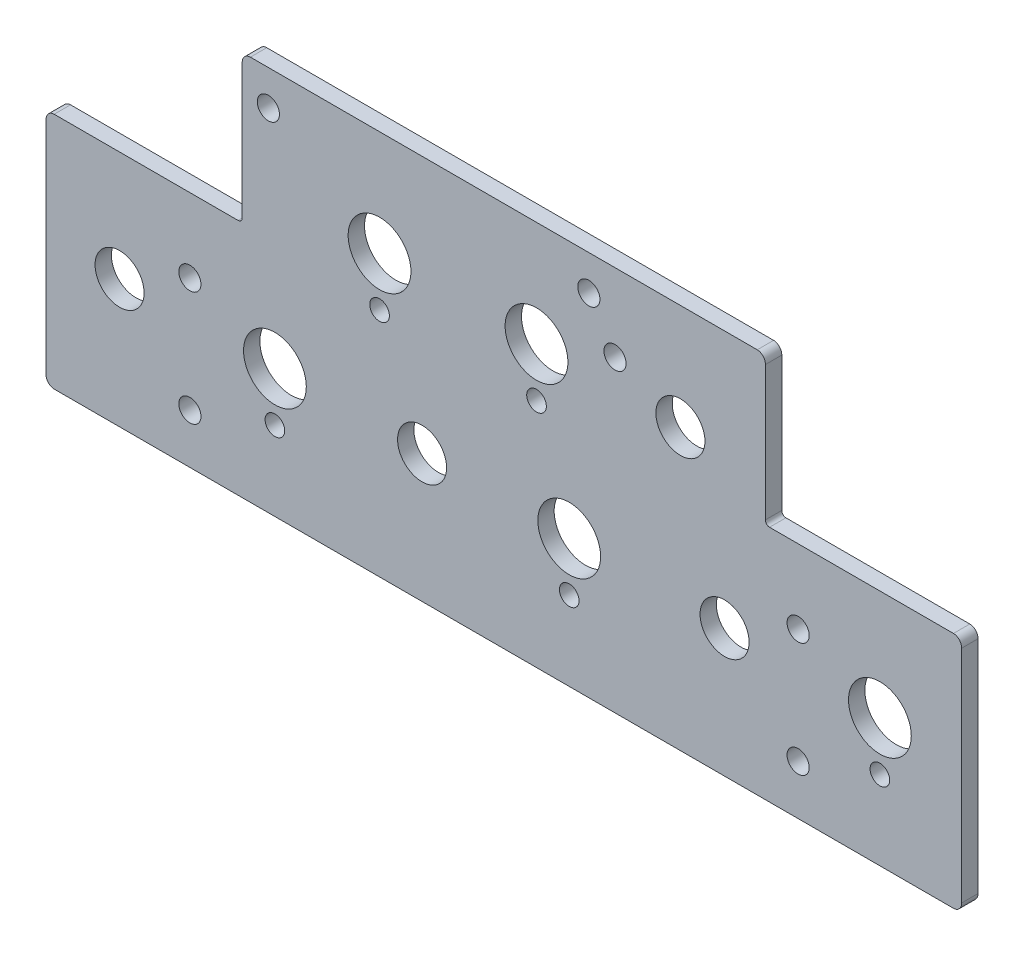
from build123d import *

# Parameters (mm, degrees)
BOSS_EXTRUDE1_DEPTH   = 3.175
SKETCH2_R             = 4.7625
CUT_EXTRUDE1_DEPTH    = 98.862396902
SKETCH4_R             = 6.096
SKETCH4_R_2           = 1.905
CUT_EXTRUDE2_DEPTH    = 98.862396902
F_6_CLEARANCE_HOLE1_D = 4.3053


with BuildPart() as part:
    # Sketch1 → Boss-Extrude1 (new body)
    with BuildSketch(Plane.XY):
        with BuildLine():
            Line((-51.59375, 5.432306697), (-87.3125, 5.432306697))
            add(Edge.make_bspline(
                [(-87.3125, 5.432306697), (-88.9, 5.432306697), (-88.9, 3.742924483)],
                knots=[3.141592654, 3.141592654, 3.141592654, 4.71238898, 4.71238898, 4.71238898], degree=2, weights=[1, 0.707106781, 1]))
            Line((-88.9, 3.742924483), (-88.9, -39.099808459))
            add(Edge.make_bspline(
                [(-88.9, -39.099808459), (-88.9, -40.789190673), (-87.3125, -40.789190673)],
                knots=[1.570796327, 1.570796327, 1.570796327, 3.141592654, 3.141592654, 3.141592654], degree=2, weights=[1, 0.707106781, 1]))
            Line((-87.3125, -40.789190673), (87.3125, -40.789190673))
            add(Edge.make_bspline(
                [(87.3125, -40.789190673), (88.9, -40.789190673), (88.9, -39.099808459)],
                knots=[3.141592654, 3.141592654, 3.141592654, 4.71238898, 4.71238898, 4.71238898], degree=2, weights=[1, 0.707106781, 1]))
            Line((88.9, -39.099808459), (88.9, 3.742924483))
            add(Edge.make_bspline(
                [(88.9, 3.742924483), (88.9, 5.432306697), (87.3125, 5.432306697)],
                knots=[1.570796327, 1.570796327, 1.570796327, 3.141592654, 3.141592654, 3.141592654], degree=2, weights=[1, 0.707106781, 1]))
            Line((87.3125, 5.432306697), (51.59375, 5.432306697))
            add(Edge.make_bspline(
                [(50.8, 6.276997804), (50.8, 5.432306697), (51.59375, 5.432306697)],
                knots=[4.71238898, 4.71238898, 4.71238898, 6.283185307, 6.283185307, 6.283185307], degree=2, weights=[1, 0.707106781, 1]))
            Line((50.8, 6.276997804), (50.8, 32.394846829))
            add(Edge.make_bspline(
                [(50.8, 32.394846829), (50.8, 34.084229043), (49.2125, 34.084229043)],
                knots=[4.71238898, 4.71238898, 4.71238898, 6.283185307, 6.283185307, 6.283185307], degree=2, weights=[1, 0.707106781, 1]))
            Line((49.2125, 34.084229043), (-49.2125, 34.084229043))
            add(Edge.make_bspline(
                [(-49.2125, 34.084229043), (-50.8, 34.084229043), (-50.8, 32.394846829)],
                knots=[0, 0, 0, 1.570796327, 1.570796327, 1.570796327], degree=2, weights=[1, 0.707106781, 1]))
            Line((-50.8, 32.394846829), (-50.8, 6.276997804))
            add(Edge.make_bspline(
                [(-51.59375, 5.432306697), (-50.8, 5.432306697), (-50.8, 6.276997804)],
                knots=[0, 0, 0, 1.570796327, 1.570796327, 1.570796327], degree=2, weights=[1, 0.707106781, 1]))
        make_face()
    extrude(amount=BOSS_EXTRUDE1_DEPTH)

    # Sketch2 → Cut-Extrude1 (cut, through all)
    with BuildSketch(Plane.XY.offset(3.175)):
        with Locations((42.8625, -15.909796167)):
            Circle(SKETCH2_R)
        with Locations((-15.875, -15.909796167)):
            Circle(SKETCH2_R)
        with Locations((-74.6125, -15.909796167)):
            Circle(SKETCH2_R)
        with Locations((34.29, 13.617703833)):
            Circle(SKETCH2_R)
    extrude(amount=-CUT_EXTRUDE1_DEPTH, mode=Mode.SUBTRACT)

    # Sketch4 → Cut-Extrude2 (cut, through all)
    with BuildSketch(Plane.XY.offset(3.175)):
        with Locations((73.025, -15.909796167)):
            Circle(SKETCH4_R)
        with Locations((12.7, -15.909796167)):
            Circle(SKETCH4_R)
        with Locations((-44.45, -15.909796167)):
            Circle(SKETCH4_R)
        with Locations((-24.13, 13.617703833)):
            Circle(SKETCH4_R)
        with Locations((6.35, 13.617703833)):
            Circle(SKETCH4_R)
        with Locations((73.025, -25.434796167)):
            Circle(SKETCH4_R_2)
        with Locations((12.7, -25.434796167)):
            Circle(SKETCH4_R_2)
        with Locations((-44.45, -25.434796167)):
            Circle(SKETCH4_R_2)
        with Locations((6.35, 4.092703833)):
            Circle(SKETCH4_R_2)
        with Locations((-24.13, 4.092703833)):
            Circle(SKETCH4_R_2)
    extrude(amount=-CUT_EXTRUDE2_DEPTH, mode=Mode.SUBTRACT)

    # #6 Clearance Hole1 (through all)
    with Locations(Plane.XY.offset(3.175)):
        with Locations((-45.72, 27.270203833), (16.51, 27.270203833), (21.59, 19.015203833), (57.15, -8.924796167), (57.15, -31.149796167), (-60.96, -31.149796167), (-60.96, -8.924796167)):
            Hole(F_6_CLEARANCE_HOLE1_D / 2)


solid = part.part
